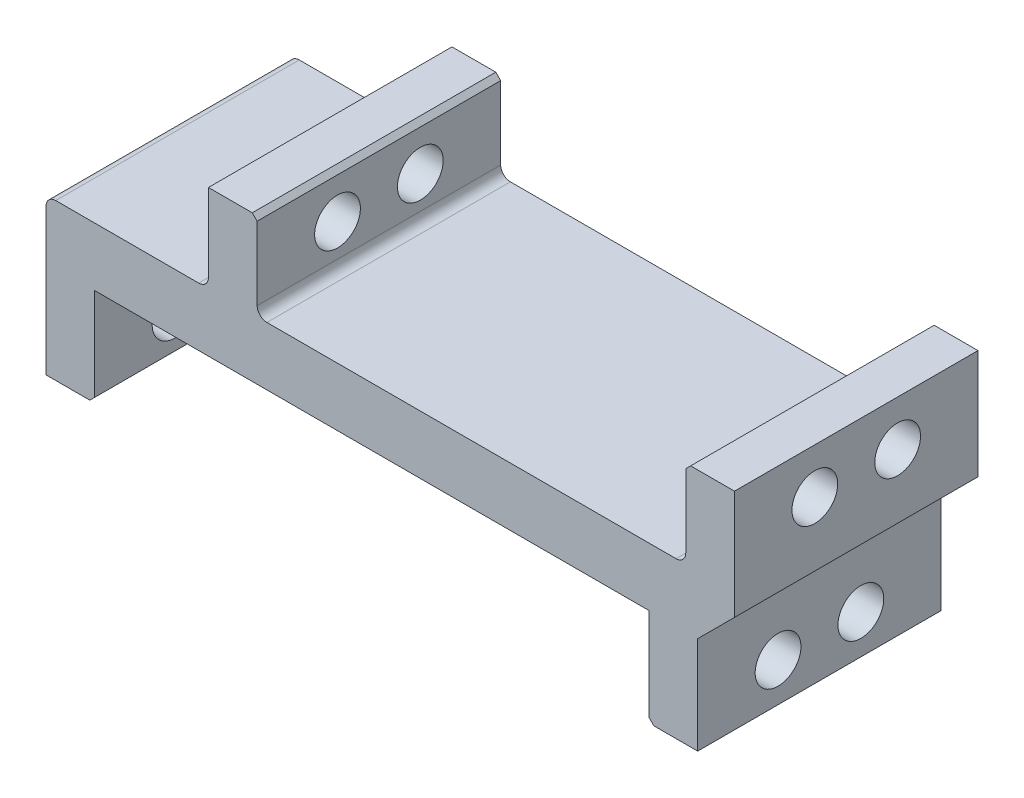
from build123d import *

# Parameters (mm, degrees)
BOSS_EXTRUDE3_DEPTH     = 12.5
CUT_EXTRUDE1_DEPTH      = 43.289958915
CUT_EXTRUDE1_DEPTH_BACK = 43.289958915
SKETCH6_R               = 2.35
CHAMFER1_SIZE           = 0.5


with BuildPart() as part:
    # Sketch5 → Boss-Extrude3 (new, symmetric)
    with BuildSketch(Plane.XY):
        with BuildLine():
            Line((33.45, 0.7), (37.225, 4.475))
            Line((37.225, 4.475), (37.225, 15.7))
            Line((37.225, 15.7), (32.225, 15.7))
            Line((32.225, 15.7), (32.225, 7.7))
            ThreePointArc((32.225, 7.7), (31.932106781, 6.992893219), (31.225, 6.7))
            Line((31.225, 6.7), (-10.775, 6.7))
            ThreePointArc((-10.775, 6.7), (-11.482106781, 6.992893219), (-11.775, 7.7))
            Line((-11.775, 7.7), (-11.775, 15.7))
            Line((-11.775, 15.7), (-16.775, 15.7))
            Line((-16.775, 15.7), (-16.775, 7.7))
            ThreePointArc((-16.775, 7.7), (-17.067893219, 6.992893219), (-17.775, 6.7))
            Line((-17.775, 6.7), (-32.45, 6.7))
            ThreePointArc((-32.45, 6.7), (-33.157106781, 6.407106781), (-33.45, 5.7))
            Line((-33.45, 5.7), (-33.45, -9.3))
            Line((-33.45, -9.3), (-28.45, -9.3))
            Line((-28.45, -9.3), (-28.45, 0.7))
            Line((-28.45, 0.7), (28.45, 0.7))
            Line((28.45, 0.7), (28.45, -9.3))
            Line((28.45, -9.3), (33.45, -9.3))
            Line((33.45, -9.3), (33.45, 0.7))
        make_face()
    extrude(amount=BOSS_EXTRUDE3_DEPTH, both=True)

    # Sketch6 → Cut-Extrude1 (cut, two sides: drawn at the far end of the back side and taken through both)
    with BuildSketch(Plane(origin=(0, 0, 0), x_dir=(0, 0, -1), z_dir=(1, 0, 0)).offset(-CUT_EXTRUDE1_DEPTH_BACK)):
        with Locations((-4.25, 11.05)):
            Circle(SKETCH6_R)
        with Locations((4.25, 11.05)):
            Circle(SKETCH6_R)
        with Locations((4.25, -5.3)):
            Circle(SKETCH6_R)
        with Locations((-4.25, -5.3)):
            Circle(SKETCH6_R)
    extrude(amount=CUT_EXTRUDE1_DEPTH + CUT_EXTRUDE1_DEPTH_BACK, mode=Mode.SUBTRACT)

    # Chamfer1
    chamfer1_edges = [part.edges().sort_by_distance(p)[0] for p in [
        (32.225, 15.7, 0),
        (-11.775, 15.7, 0),
        (28.45, -9.3, 0),
        (-28.45, -9.3, 0),
    ]]
    chamfer(chamfer1_edges, length=CHAMFER1_SIZE)


solid = part.part
